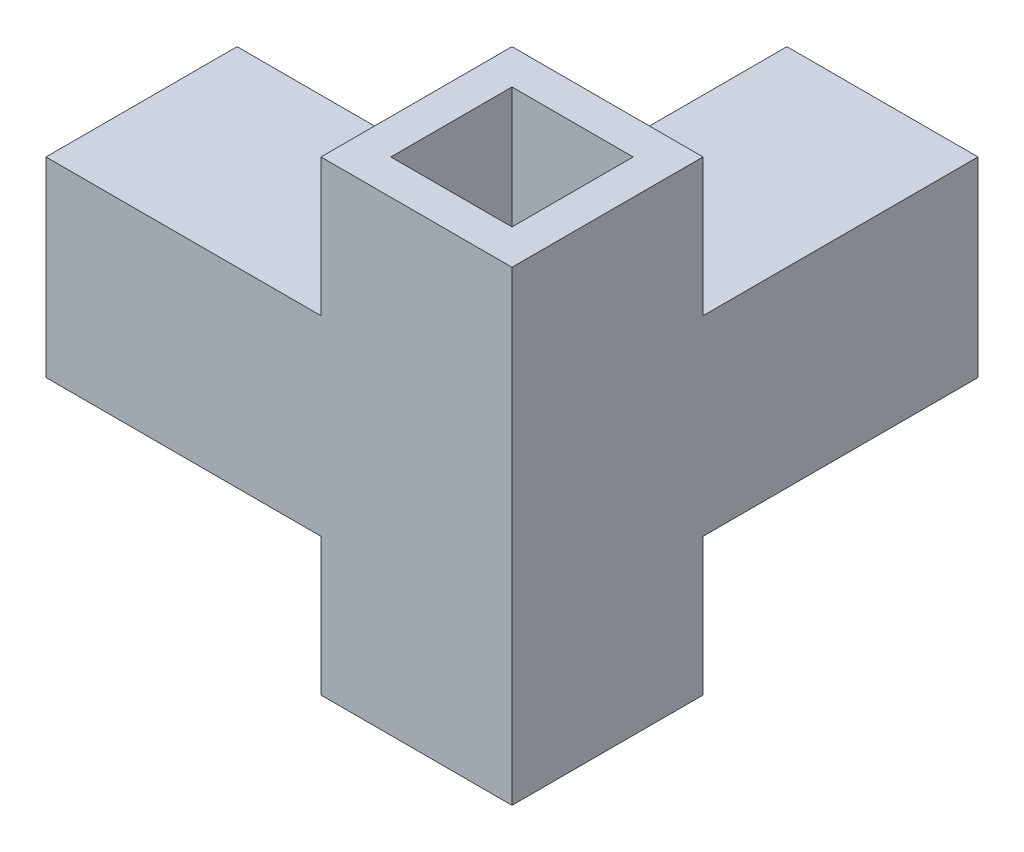
from build123d import *

# Parameters (mm, degrees)
BOSS_EXTRUDE1_DEPTH = 8.2
SHELL1_T            = -1.5
SKETCH2_W           = 8.2
SKETCH2_H           = 8.2
BOSS_EXTRUDE2_DEPTH = 11.8
SHELL2_START        = -11.8
SHELL2_OUTLINE_W    = 5.2
SHELL2_OUTLINE_H    = 5.2
SHELL2_DEPTH        = 11.8


# Read off the part's stored shape, not the designer's step: Shell2
with BuildPart() as part:
    # Sketch1 → Boss-Extrude1 (new body)
    with BuildSketch(Plane(origin=(0, 0, 0), x_dir=(0, 0, -1), z_dir=(1, 0, 0))):
        Polygon((0, 10), (0, -10), (8.2, -10), (8.2, -4.1), (20, -4.1), (20, 4.1), (8.2, 4.1), (8.2, 10), align=None)
    extrude(amount=BOSS_EXTRUDE1_DEPTH)

    # Shell1
    shell1_openings = [part.faces().sort_by_distance(p)[0] for p in [
        (4.1, -10, -4.1),
        (4.1, 10, -4.1),
        (4.1, 0, -20),
    ]]
    offset(amount=SHELL1_T, openings=shell1_openings, kind=Kind.INTERSECTION)

    # Sketch2 → Boss-Extrude2 (add)
    with BuildSketch(Plane.ZY):
        with Locations((-4.1, 0)):
            Rectangle(SKETCH2_W, SKETCH2_H)
    extrude(amount=BOSS_EXTRUDE2_DEPTH)

    # Shell2 outline → Shell2 (cut)
    with BuildSketch(Plane.YZ.offset(SHELL2_START)):
        with Locations((0, -4.1)):
            Rectangle(SHELL2_OUTLINE_W, SHELL2_OUTLINE_H)
    extrude(amount=SHELL2_DEPTH, mode=Mode.SUBTRACT)


solid = part.part
